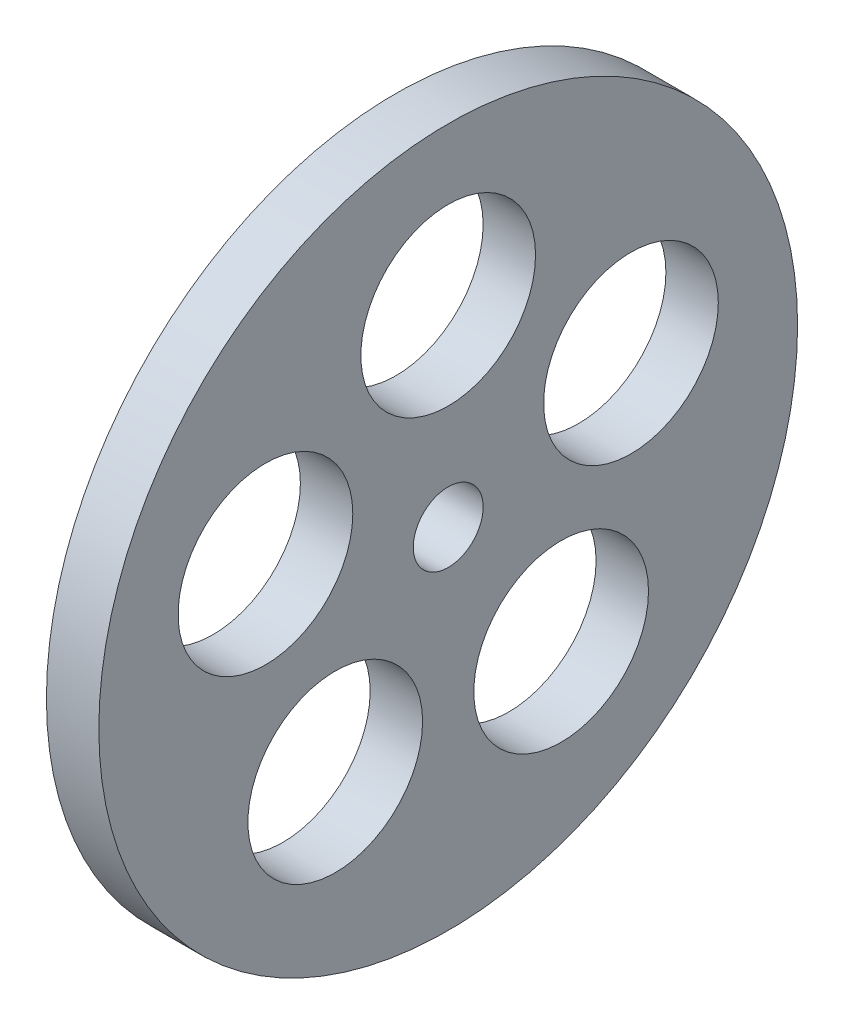
from build123d import *

# Parameters (mm, degrees)
SKETCH1_R           = 40
SKETCH1_R_2         = 4
SKETCH1_R_3         = 10
BOSS_EXTRUDE1_DEPTH = 6


with BuildPart() as part:
    # Sketch1 → Boss-Extrude1 (new body)
    with BuildSketch(Plane(origin=(0, 0, 0), x_dir=(0, 0, -1), z_dir=(1, 0, 0))):
        Circle(SKETCH1_R)
        Circle(SKETCH1_R_2, mode=Mode.SUBTRACT)
        with Locations((0, 22)):
            Circle(SKETCH1_R_3, mode=Mode.SUBTRACT)
        with Locations((20.923243358, 6.798373876)):
            Circle(SKETCH1_R_3, mode=Mode.SUBTRACT)
        with Locations((12.93127555, -17.798373876)):
            Circle(SKETCH1_R_3, mode=Mode.SUBTRACT)
        with Locations((-12.93127555, -17.798373876)):
            Circle(SKETCH1_R_3, mode=Mode.SUBTRACT)
        with Locations((-20.923243358, 6.798373876)):
            Circle(SKETCH1_R_3, mode=Mode.SUBTRACT)
    extrude(amount=BOSS_EXTRUDE1_DEPTH)


solid = part.part
